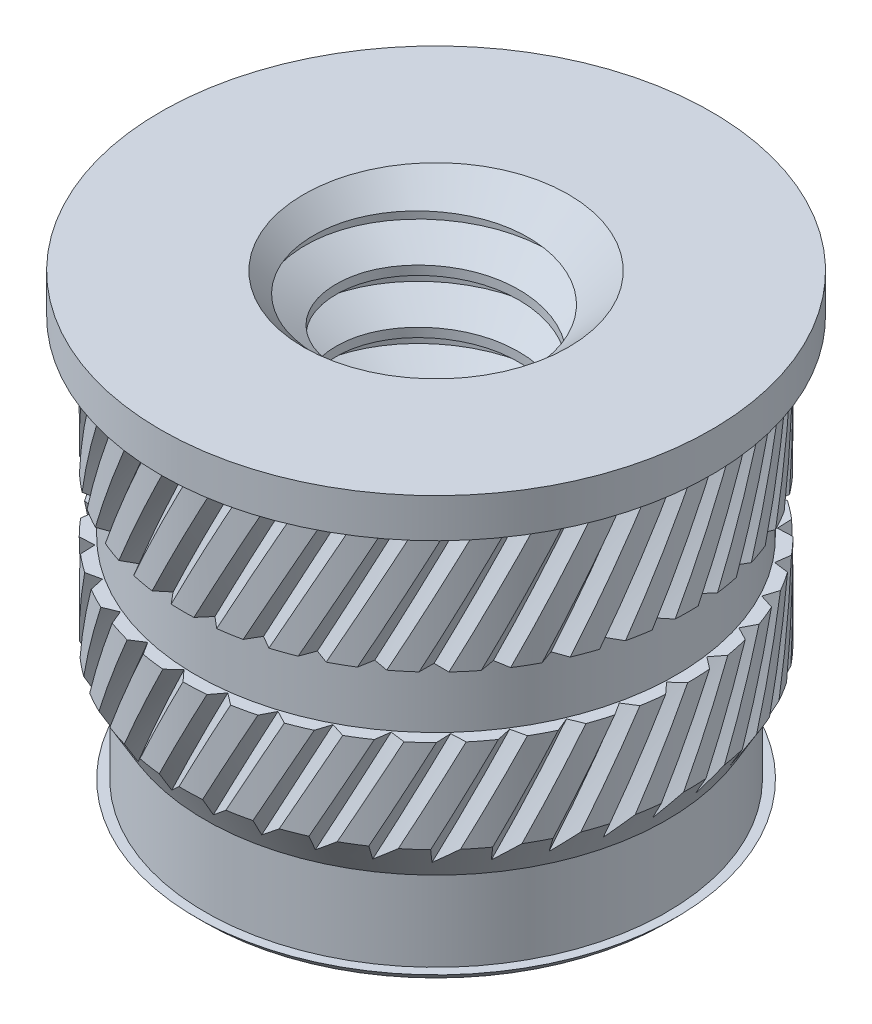
from build123d import *

# Parameters (mm, degrees)
SKETCH1_R              = 1.5
EXTRUDE1_DEPTH         = 2.92
SKETCH1_4_R            = 1.64
EXTRUDE2_DEPTH         = 2.098936
SKETCH1_3_R            = 1.79
EXTRUDE3_DEPTH         = 0.254
SKETCH2_R              = 1.64
EXTRUDE4_DEPTH         = 0.242487
EXTRUDE4_TAPER         = 30
SKETCH8_R              = 0.597927406
EXTRUDE6_DEPTH         = 2.92
CHAMFER1_SIZE          = 0.2625
CUT_SWEEP1_PITCH       = 0.35
CUT_SWEEP1_HEIGHT      = 3.584159265
CUT_SWEEP1_RADIUS      = 0.8
CUT_SWEEP1_START_ANGLE = -90
CUT_SWEEP2_PITCH       = 19.835
CUT_SWEEP2_HEIGHT      = 1.9835
CUT_SWEEP2_RADIUS      = 1.64
CUT_SWEEP2_START_ANGLE = -180
CIRPATTERN1_COUNT      = 36
SKETCH11_W             = 0.23
SKETCH11_H             = 0.3967


# Read off the part's stored shape, not the designer's step: Extrude5
with BuildPart() as part:
    # Sketch1 → Extrude1 (new body)
    with BuildSketch(Plane(origin=(0, 0, 0), x_dir=(1, 0, 0), z_dir=(0, 1, 0))):
        with Locations(Location((0, 0, 0), (0, 0, 270))):
            Circle(SKETCH1_R)
    extrude(amount=-EXTRUDE1_DEPTH)

    # Sketch1<4> → Extrude2 (add)
    with BuildSketch(Plane(origin=(0, 0, 0), x_dir=(1, 0, 0), z_dir=(0, 1, 0))):
        with Locations(Location((0, 0, 0), (0, 0, 270))):
            Circle(SKETCH1_4_R)
    extrude(amount=-EXTRUDE2_DEPTH)

    # Sketch1<3> → Extrude3 (add)
    with BuildSketch(Plane(origin=(0, 0, 0), x_dir=(1, 0, 0), z_dir=(0, 1, 0))):
        with Locations(Location((0, 0, 0), (0, 0, 270))):
            Circle(SKETCH1_3_R)
    extrude(amount=-EXTRUDE3_DEPTH)

    # Sketch2 → Extrude4 (add)
    with BuildSketch(Plane.XZ.offset(2.098935935)):
        with Locations(Location((0, 0, 0), (0, 0, 90))):
            Circle(SKETCH2_R)
    extrude(amount=EXTRUDE4_DEPTH, taper=EXTRUDE4_TAPER)

    # Extrude5 outline → Extrude5 (revolve)
    with BuildSketch(Plane.XY):
        Polygon((1.5, -2.86), (1.5, -2.92), (1.56, -2.86), align=None)
    revolve(axis=Axis((0, 0, 0), (0, 1, 0)))

    # Sketch8 → Extrude6 (cut)
    with BuildSketch(Plane(origin=(0, 0, 0), x_dir=(1, 0, 0), z_dir=(0, 1, 0))):
        with Locations(Location((0, 0, 0), (0, 0, 270))):
            Circle(SKETCH8_R)
    extrude(amount=-EXTRUDE6_DEPTH, mode=Mode.SUBTRACT)

    # Chamfer1
    chamfer1_edges = [part.edges().sort_by_distance(p)[0] for p in [
        (0, -2.92, -0.597927406),
        (0, 0, -0.597927406),
    ]]
    chamfer(chamfer1_edges, length=CHAMFER1_SIZE)

    # Cut-Sweep1: sweep along a helix
    with BuildLine() as cut_sweep1_path:
        add(Helix(CUT_SWEEP1_PITCH, CUT_SWEEP1_HEIGHT, CUT_SWEEP1_RADIUS, center=(0, 0, 0), direction=(0, -1, 0), mode=Mode.PRIVATE).rotate(Axis((0, 0, 0), (0, -1, 0)), CUT_SWEEP1_START_ANGLE))
    # Sketch7 → Cut-Sweep1 (sweep, cut)
    with BuildSketch(Plane.XY):
        Polygon((-0.8, 0.175), (-0.8, 0.116666667), (-0.572668332, -0.014583333), (-0.572668332, 0.30625), align=None)
    sweep(path=cut_sweep1_path.line, is_frenet=True, mode=Mode.SUBTRACT)

    # Cut-Sweep2: sweep along a helix
    with BuildLine() as cut_sweep2_path:
        add(Helix(CUT_SWEEP2_PITCH, CUT_SWEEP2_HEIGHT, CUT_SWEEP2_RADIUS, center=(0, -0.254, 0), direction=(0, -1, 0), mode=Mode.PRIVATE).rotate(Axis((0, -0.254, 0), (0, -1, 0)), CUT_SWEEP2_START_ANGLE))
    # Sketch10 → Cut-Sweep2 (sweep, cut)
    with BuildSketch(Plane.XZ.offset(0.254)):
        Polygon((0, 1.57), (-0.07, 1.64), (0.07, 1.64), align=None)
    cut_sweep2 = sweep(path=cut_sweep2_path.line, is_frenet=True, mode=Mode.SUBTRACT)

    # CirPattern1: Cut-Sweep2 ×36 about axis
    cirpattern1_axis = Axis((0, -2.098935935, 0), (0, 1, 0))
    for i in range(1, CIRPATTERN1_COUNT):
        add(cut_sweep2.rotate(cirpattern1_axis, i * 360 / CIRPATTERN1_COUNT), mode=Mode.SUBTRACT)

    # Sketch11 → Cut-Revolve1 (revolve, cut)
    with BuildSketch(Plane.XY, mode=Mode.PRIVATE) as cut_revolve1_sk:
        with Locations((-1.675, -1.297711524)):
            Rectangle(SKETCH11_W, SKETCH11_H)
    revolve(cut_revolve1_sk.sketch.rotate(Axis((0, 0, 0), (0, -1, 0)), 90), axis=Axis((0, 0, 0), (0, -1, 0)), mode=Mode.SUBTRACT)


solid = part.part
